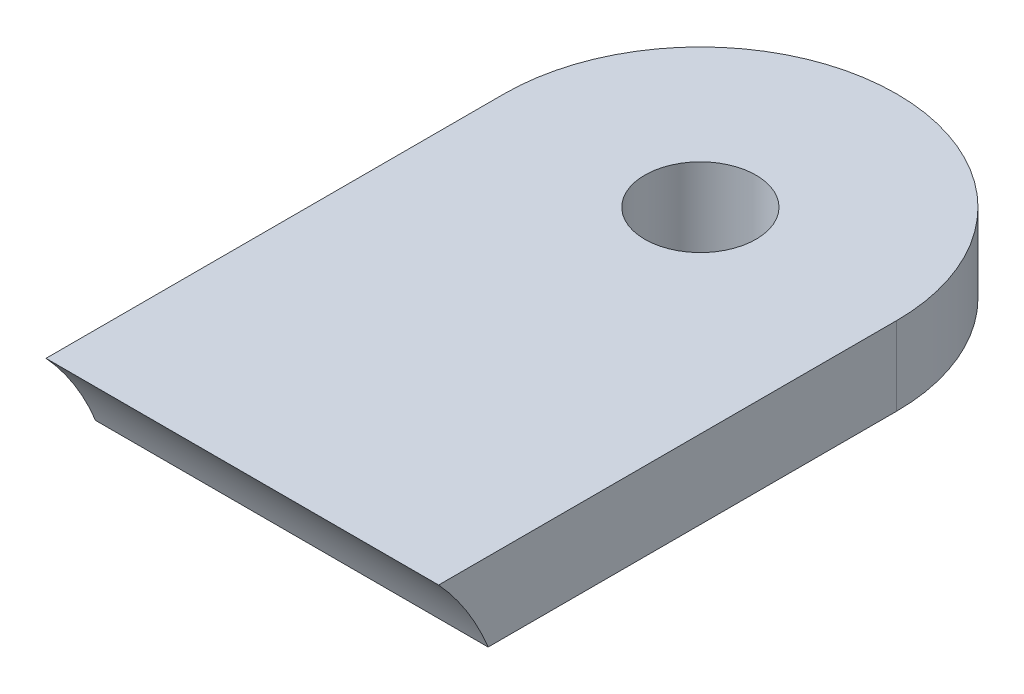
from build123d import *

# Parameters (mm, degrees)
SKETCH1_W           = 30
SKETCH1_H           = 50
SKETCH1_R           = 4.25
BOSS_EXTRUDE1_DEPTH = 6
FILLET1_R           = 15
SKETCH2_R           = 20
CUT_EXTRUDE1_DEPTH  = 59.617403559


with BuildPart() as part:
    # Sketch1 → Boss-Extrude1 (new body)
    with BuildSketch(Plane(origin=(0, 0, 0), x_dir=(1, 0, 0), z_dir=(0, 1, 0))):
        with Locations((-15, 25)):
            Rectangle(SKETCH1_W, SKETCH1_H)
        with Locations(Location((-15, 35, 0), (0, 0, 270))):
            Circle(SKETCH1_R, mode=Mode.SUBTRACT)
    extrude(amount=BOSS_EXTRUDE1_DEPTH)

    # Fillet1
    fillet1_edges = [part.edges().sort_by_distance(p)[0] for p in [
        (-30, 3, -50),
        (0, 3, -50),
    ]]
    fillet(fillet1_edges, radius=FILLET1_R - 0.0001)  # a hair under: the kernel refuses the full size

    # Sketch2 → Cut-Extrude1 (cut, through all)
    with BuildSketch(Plane.ZY.offset(30)):
        with Locations((14.756354563, -7.5)):
            Circle(SKETCH2_R)
    extrude(amount=-CUT_EXTRUDE1_DEPTH, mode=Mode.SUBTRACT)


solid = part.part
